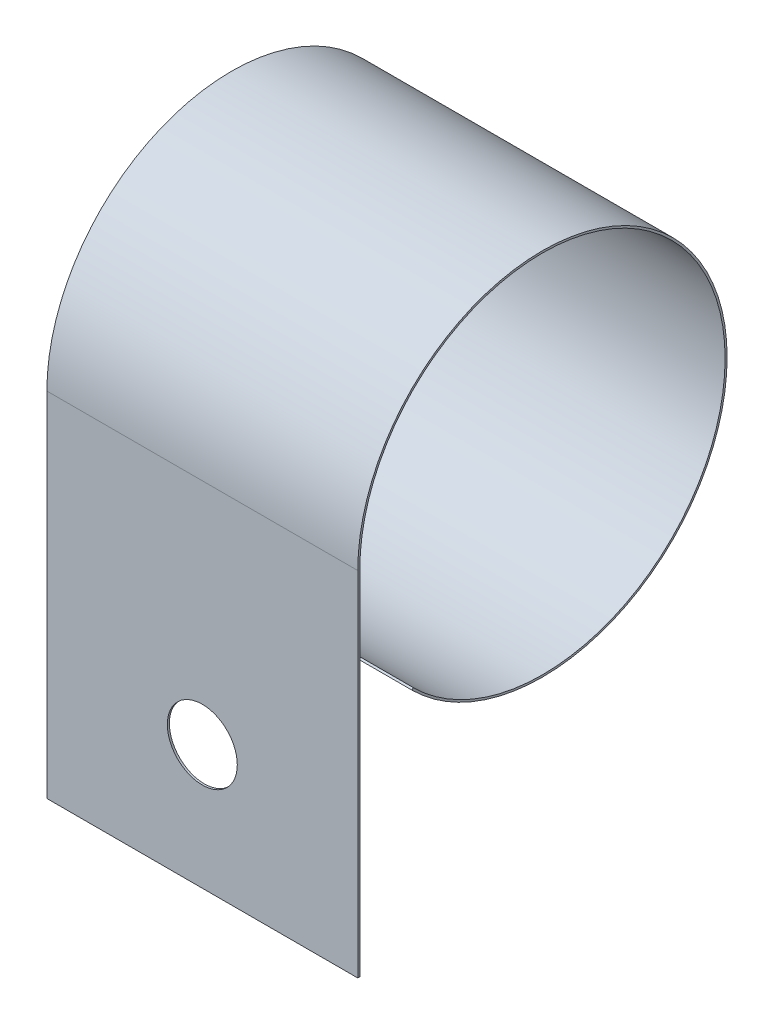
from build123d import *

# Parameters (mm, degrees)
BOSS_EXTRUDE1_DEPTH = 10
CUT_EXTRUDE1_REACH  = 36.349
SKETCH2_R           = 2.25


with BuildPart() as part:
    # Sketch1 → Boss-Extrude1 (new, symmetric)
    with BuildSketch(Plane(origin=(0, 0, 0), x_dir=(0, -1, 0), z_dir=(1, 0, 0))):
        with BuildLine():
            Line((8.40042856, -8.40042856), (8.308504679, -8.308504679))
            ThreePointArc((8.308504679, -8.308504679), (-4.49653033, 10.855584507), (0, -11.75))
            Line((0, -11.75), (22.7, -11.75))
            Line((22.7, -11.75), (22.7, -11.88))
            Line((22.7, -11.88), (0, -11.88))
            ThreePointArc((0, -11.88), (-4.546279176, 10.975688846), (8.40042856, -8.40042856))
        make_face()
    extrude(amount=BOSS_EXTRUDE1_DEPTH, both=True)

    # Sketch2 → Cut-Extrude1 (cut, up to next)
    with BuildSketch(Plane(origin=(0, 0, 11.88), x_dir=(-1, 0, 0), z_dir=(0, 0, -1)), mode=Mode.PRIVATE) as cut_extrude1_sk1:
        with Locations((0, -14.7)):
            Circle(SKETCH2_R)
    cut_extrude1_tool1 = extrude(cut_extrude1_sk1.sketch, amount=CUT_EXTRUDE1_REACH, mode=Mode.PRIVATE) & part.part
    add(cut_extrude1_tool1.solids().sort_by_distance((0, -14.7, 11.88))[0], mode=Mode.SUBTRACT)


solid = part.part
